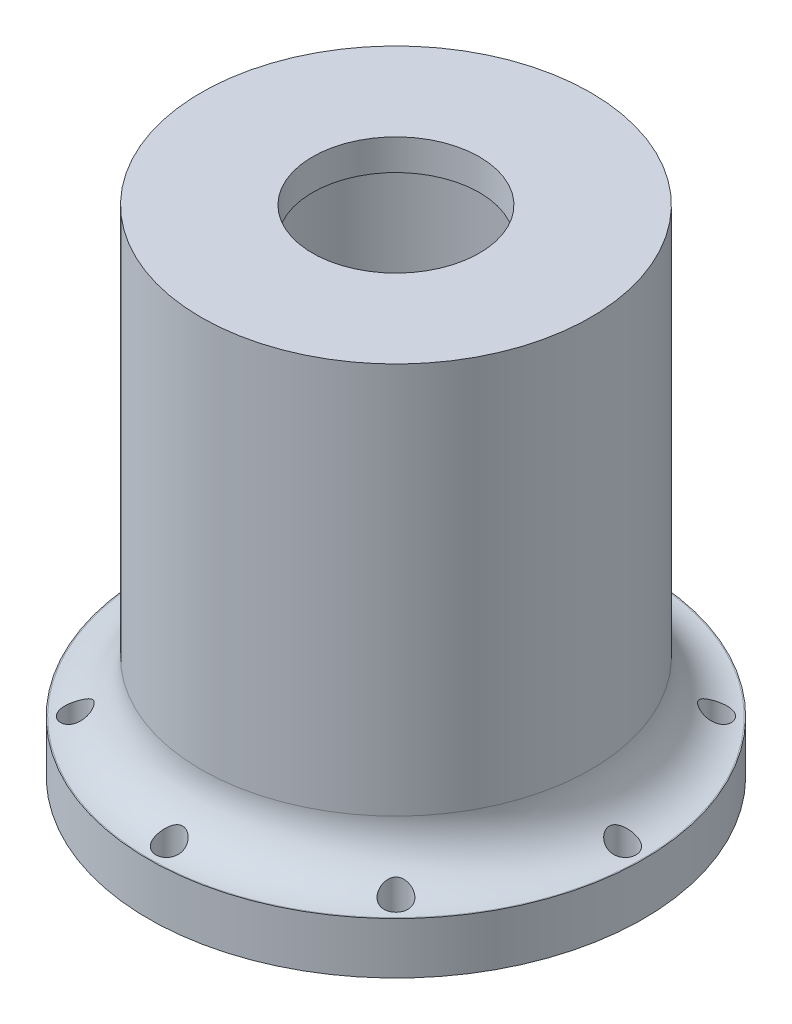
from build123d import *

# Parameters (mm, degrees)
CONG_3_R                     = 5
ESQUISSE4_R                  = 1.3
ENL_V_MAT_EXTRU_1_DEPTH      = 59.787753827
R_P_TITION_CIRCULAIRE2_COUNT = 8


with BuildPart() as part:
    # Esquisse1 → Révolution1 (revolve)
    with BuildSketch(Plane.XY):
        Polygon((13.9, 0), (13.9, 45), (8.1, 45), (8.1, 48), (18.9, 48), (18.9, 5), (24, 5), (24, 0), align=None)
    revolve(axis=Axis((0, -1.825, 0), (0, 1, 0)))

    # Congé3
    cong_3_edges = [part.edges().sort_by_distance(p)[0] for p in [
        (-18.9, 5, 0),
    ]]
    fillet(cong_3_edges, radius=CONG_3_R)

    # Esquisse4 → Enlèv. mat.-Extru.1 (cut, through all)
    with BuildSketch(Plane(origin=(0, 0, 0), x_dir=(-1, 0, 0), z_dir=(0, -1, 0))):
        with Locations((0, -22)):
            Circle(ESQUISSE4_R)
    enl_v_mat_extru_1 = extrude(amount=-ENL_V_MAT_EXTRU_1_DEPTH, mode=Mode.SUBTRACT)

    # Répétition circulaire2: Enlèv. mat.-Extru.1 ×8 about axis
    r_p_tition_circulaire2_axis = Axis((0, -1.825, 0), (0, 1, 0))
    for i in range(1, R_P_TITION_CIRCULAIRE2_COUNT):
        add(enl_v_mat_extru_1.rotate(r_p_tition_circulaire2_axis, i * 360 / R_P_TITION_CIRCULAIRE2_COUNT), mode=Mode.SUBTRACT)


solid = part.part
